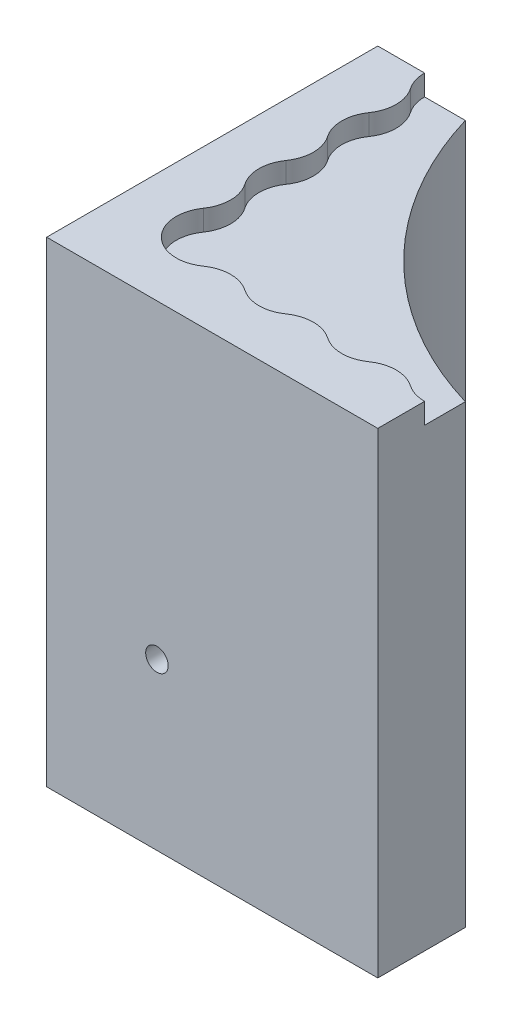
from build123d import *

# Parameters (mm, degrees)
SKETCH1_W                 = 50.8
SKETCH1_H                 = 50.8
BOSS_EXTRUDE1_DEPTH       = 73.025
CUT_EXTRUDE1_DEPTH        = 3.175
SKETCH3_R                 = 55.5625
CUT_EXTRUDE2_DEPTH        = 103.439887861
F_8_32_TAPPED_HOLE1_D     = 3.4544
F_8_32_TAPPED_HOLE1_DEPTH = 10.70864
F_8_32_TAPPED_HOLE1_TIP   = 1.037806461
F_8_32_TAPPED_HOLE2_D     = 3.4544
F_8_32_TAPPED_HOLE2_DEPTH = 10.70864
F_8_32_TAPPED_HOLE2_TIP   = 1.037806461


with BuildPart() as part:
    # Sketch1 → Boss-Extrude1 (new body)
    with BuildSketch(Plane(origin=(0, 0, 0), x_dir=(1, 0, 0), z_dir=(0, 1, 0))):
        with Locations((25.4, 25.4)):
            Rectangle(SKETCH1_W, SKETCH1_H)
    extrude(amount=BOSS_EXTRUDE1_DEPTH)

    # Sketch2 → Cut-Extrude1 (cut)
    with BuildSketch(Plane(origin=(0, 73.025, 0), x_dir=(1, 0, 0), z_dir=(0, 1, 0))):
        with BuildLine():
            Line((130.016993909, 125.017737196), (134.25782275, 78.573759143))
            ThreePointArc((134.25782275, 78.573759143), (134.034685181, 75.298190088), (132.798116214, 72.256802214))
            ThreePointArc((132.798116214, 72.256802214), (130.01096738, 66.280890285), (128.580118229, 59.844090402))
            ThreePointArc((128.580118229, 59.844090402), (125.846501332, 47.24207899), (120.576283082, 35.473130329))
            ThreePointArc((120.576283082, 35.473130329), (120.013426501, 34.114565768), (119.824473194, 32.656209898))
            ThreePointArc((119.824473194, 32.656209898), (117.90735564, 28.45485307), (113.469501546, 27.177281171))
            ThreePointArc((113.469501546, 27.177281171), (106.116591491, 23.83727612), (106.198458812, 15.761744078))
            ThreePointArc((106.198458812, 15.761744078), (105.465515747, 8.75311664), (98.443142857, 8.166309094))
            ThreePointArc((98.443142857, 8.166309094), (95.25, 9.168506799), (92.056857143, 8.166309094))
            ThreePointArc((92.056857143, 8.166309094), (88.9, 7.1755), (85.743142857, 8.166309094))
            ThreePointArc((85.743142857, 8.166309094), (82.55, 9.168506799), (79.356857143, 8.166309094))
            ThreePointArc((79.356857143, 8.166309094), (76.212257074, 7.175513597), (73.063291467, 8.152345678))
            ThreePointArc((73.063291467, 8.152345678), (69.907489389, 9.140393728), (66.74574768, 8.171520637))
            ThreePointArc((66.74574768, 8.171520637), (63.508942298, 7.175501389), (60.273525168, 8.176020964))
            ThreePointArc((60.273525168, 8.176020964), (57.10532095, 9.149271709), (53.943097961, 8.156759366))
            ThreePointArc((53.943097961, 8.156759366), (50.791625748, 7.175506347), (47.643142857, 8.166309094))
            ThreePointArc((47.643142857, 8.166309094), (44.45, 9.168506799), (41.256857143, 8.166309094))
            ThreePointArc((41.256857143, 8.166309094), (38.1, 7.1755), (34.943142857, 8.166309094))
            ThreePointArc((34.943142857, 8.166309094), (31.75, 9.168506799), (28.556857143, 8.166309094))
            ThreePointArc((28.556857143, 8.166309094), (25.4, 7.1755), (22.243142857, 8.166309094))
            ThreePointArc((22.243142857, 8.166309094), (19.05, 9.168506799), (15.856857143, 8.166309094))
            ThreePointArc((15.856857143, 8.166309094), (8.793588587, 8.793588587), (8.166309094, 15.856857143))
            ThreePointArc((8.166309094, 15.856857143), (9.168506799, 19.05), (8.166309094, 22.243142857))
            ThreePointArc((8.166309094, 22.243142857), (7.1755, 25.4), (8.166309094, 28.556857143))
            ThreePointArc((8.166309094, 28.556857143), (9.168506799, 31.75), (8.166309094, 34.943142857))
            ThreePointArc((8.166309094, 34.943142857), (7.1755, 38.1), (8.166309094, 41.256857143))
            ThreePointArc((8.166309094, 41.256857143), (9.168506799, 44.45), (8.166309094, 47.643142857))
            ThreePointArc((8.166309094, 47.643142857), (7.175506347, 50.791625748), (8.156759366, 53.943097961))
            ThreePointArc((8.156759366, 53.943097961), (9.149271709, 57.10532095), (8.176020964, 60.273525168))
            ThreePointArc((8.176020964, 60.273525168), (7.175501389, 63.508942298), (8.171520637, 66.74574768))
            ThreePointArc((8.171520637, 66.74574768), (9.140393728, 69.907489389), (8.152345678, 73.063291467))
            ThreePointArc((8.152345678, 73.063291467), (7.175513597, 76.212257074), (8.166309094, 79.356857143))
            ThreePointArc((8.166309094, 79.356857143), (9.168506799, 82.55), (8.166309094, 85.743142857))
            ThreePointArc((8.166309094, 85.743142857), (7.1755, 88.9), (8.166309094, 92.056857143))
            ThreePointArc((8.166309094, 92.056857143), (9.168506799, 95.25), (8.166309094, 98.443142857))
            ThreePointArc((8.166309094, 98.443142857), (8.75311664, 105.465515747), (15.761744078, 106.198458812))
            ThreePointArc((15.761744078, 106.198458812), (23.83727612, 106.116591491), (27.177281171, 113.469501546))
            ThreePointArc((27.177281171, 113.469501546), (28.45485307, 117.90735564), (32.656209898, 119.824473194))
            ThreePointArc((32.656209898, 119.824473194), (34.114565768, 120.013426501), (35.473130329, 120.576283082))
            ThreePointArc((35.473130329, 120.576283082), (47.24207899, 125.846501332), (59.844090402, 128.580118229))
            ThreePointArc((59.844090402, 128.580118229), (68.705211612, 130.952457845), (76.452938417, 135.863689229))
            ThreePointArc((76.452938417, 135.863689229), (80.625736152, 138.0725352), (85.345346996, 138.201045691))
            Line((85.345346996, 138.201045691), (125.626948268, 129.926898817))
            ThreePointArc((125.626948268, 129.926898817), (128.63345164, 128.197989094), (130.016993909, 125.017737196))
        make_face()
    extrude(amount=-CUT_EXTRUDE1_DEPTH, mode=Mode.SUBTRACT)

    # Sketch3 → Cut-Extrude2 (cut, through all)
    with BuildSketch(Plane(origin=(0, 73.025, 0), x_dir=(1, 0, 0), z_dir=(0, 1, 0))):
        with Locations((66.675, 66.675)):
            Circle(SKETCH3_R)
    extrude(amount=-CUT_EXTRUDE2_DEPTH, mode=Mode.SUBTRACT)

    # #8-32 Tapped Hole1
    with Locations(Plane(origin=(393.7, -15.875, 0), x_dir=(1, 0, 0), z_dir=(0, 0, 1))):
        with Locations((-376.782, 41.275)):
            Hole(F_8_32_TAPPED_HOLE1_D / 2, depth=F_8_32_TAPPED_HOLE1_DEPTH)
            with Locations((0, 0, -(F_8_32_TAPPED_HOLE1_DEPTH + F_8_32_TAPPED_HOLE1_TIP / 2))):  # 118° drill point
                Cone(0, F_8_32_TAPPED_HOLE1_D / 2, F_8_32_TAPPED_HOLE1_TIP, mode=Mode.SUBTRACT)

    # #8-32 Tapped Hole2
    with Locations(Plane(origin=(0, -15.875, -393.7), x_dir=(0, 0, 1), z_dir=(-1, 0, 0))):
        with Locations((374.968, 41.275)):
            Hole(F_8_32_TAPPED_HOLE2_D / 2, depth=F_8_32_TAPPED_HOLE2_DEPTH)
            with Locations((0, 0, -(F_8_32_TAPPED_HOLE2_DEPTH + F_8_32_TAPPED_HOLE2_TIP / 2))):  # 118° drill point
                Cone(0, F_8_32_TAPPED_HOLE2_D / 2, F_8_32_TAPPED_HOLE2_TIP, mode=Mode.SUBTRACT)


solid = part.part
